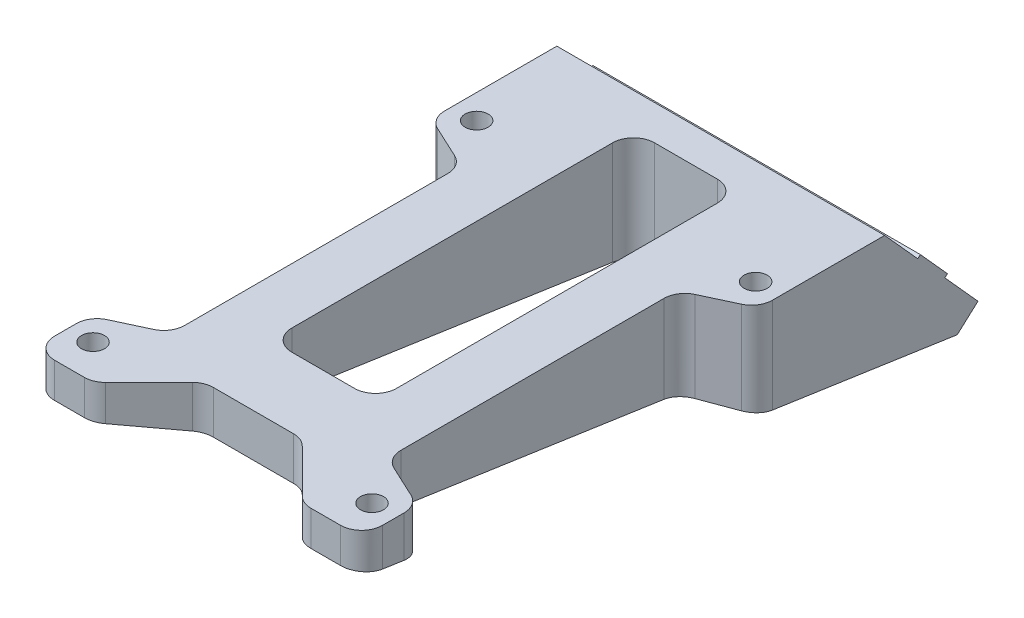
from build123d import *

# Parameters (mm, degrees)
EXTRUDE_2_DEPTH     = 5
SKETCH_3_R          = 1.65
CUT_EXTRUDE_1_DEPTH = 79.754364958
EXTRUDE_3_DEPTH     = 23.5
SKETCH_6_R          = 2.6
CUT_EXTRUDE_3_DEPTH = 83.719354566
CUT_EXTRUDE_4_REACH = 89.719
CUT_EXTRUDE_START   = -5
SKETCH_7_R          = 4.5
CUT_EXTRUDE_5_REACH = 85.529
CUT_EXTRUDE_START_2 = 3
SKETCH_8_R          = 3
SKETCH_4_W          = 15
SKETCH_4_H          = 52
CUT_EXTRUDE_2_DEPTH = 81.528760183
FILLET_1_R          = 3


with BuildPart() as part:
    # 草图2 → 凸台-拉伸2 (new body)
    with BuildSketch(Plane(origin=(0, 0, 0), x_dir=(1, 0, 0), z_dir=(0, 1, 0))):
        Polygon((0, 0), (23.5, 0), (23.5, -14), (23.5, -75), (0, -75), align=None)
    extrude_2 = extrude(amount=EXTRUDE_2_DEPTH)

    # 镜向1: 凸台-拉伸2 across plane
    add(extrude_2.mirror(Plane(origin=(0, 5, 75), x_dir=(0, 0, 1), z_dir=(1, 0, 0))))

    # 草图3 → 切除-拉伸1 (cut, through all)
    with BuildSketch(Plane(origin=(0, 5, 0), x_dir=(1, 0, 0), z_dir=(0, 1, 0))):
        with Locations((-20, -15)):
            Circle(SKETCH_3_R)
        with Locations((20, -15)):
            Circle(SKETCH_3_R)
        with Locations((-20, -70)):
            Circle(SKETCH_3_R)
        with Locations((20, -70)):
            Circle(SKETCH_3_R)
    extrude(amount=-CUT_EXTRUDE_1_DEPTH, mode=Mode.SUBTRACT)

    # 草图5 → 凸台-拉伸3 (add, symmetric)
    with BuildSketch(Plane(origin=(0, 0, 0), x_dir=(0, 0, -1), z_dir=(1, 0, 0))):
        Polygon((0, 0), (-75, 0), (10.410032825, -12.539418935), (13.382612127, -9.86289651), (8.631784822, -4.586568249), (9.003357235, -4.252002945), (5.122399718, 0.058237042), (4.750827305, -0.276328261), (0, 5), align=None)
    extrude(amount=EXTRUDE_3_DEPTH, both=True)

    # 草图6 → 切除-拉伸3 (cut, through all)
    with BuildSketch(Plane(origin=(0, 2.573244145, -2.857877151), x_dir=(1, 0, 0), z_dir=(0, 0.6691306063588544, -0.7431448254773979))):
        with Locations((-13.5, 6.284275873)):
            Circle(SKETCH_6_R)
        with Locations((13.5, 6.284275873)):
            Circle(SKETCH_6_R)
    extrude(amount=-CUT_EXTRUDE_3_DEPTH, mode=Mode.SUBTRACT)

    # 草图7 → 切除-拉伸4 (cut, up to next)
    with BuildSketch(Plane(origin=(0, 2.573244145, -2.857877151), x_dir=(1, 0, 0), z_dir=(0, 0.6691306063588544, -0.7431448254773979)).offset(CUT_EXTRUDE_START), mode=Mode.PRIVATE) as cut_extrude_4_sk1:
        with Locations((-13.5, 6.284275873)):
            Circle(SKETCH_7_R)
    cut_extrude_4_tool1 = extrude(cut_extrude_4_sk1.sketch, amount=-CUT_EXTRUDE_4_REACH, mode=Mode.PRIVATE) & part.part
    # 草图7 → 切除-拉伸4 (cut, up to next)
    with BuildSketch(Plane(origin=(0, 2.573244145, -2.857877151), x_dir=(1, 0, 0), z_dir=(0, 0.6691306063588544, -0.7431448254773979)).offset(CUT_EXTRUDE_START), mode=Mode.PRIVATE) as cut_extrude_4_sk2:
        with Locations((13.5, 6.284275873)):
            Circle(SKETCH_7_R)
    cut_extrude_4_tool2 = extrude(cut_extrude_4_sk2.sketch, amount=-CUT_EXTRUDE_4_REACH, mode=Mode.PRIVATE) & part.part
    add(cut_extrude_4_tool1.solids().sort_by_distance((-13.5, -5.442536, -3.347154))[0], mode=Mode.SUBTRACT)
    add(cut_extrude_4_tool2.solids().sort_by_distance((13.5, -5.442536, -3.347154))[0], mode=Mode.SUBTRACT)

    # 草图8 → 切除-拉伸5 (cut, up to next)
    with BuildSketch(Plane.XZ.offset(-5).offset(CUT_EXTRUDE_START_2), mode=Mode.PRIVATE) as cut_extrude_5_sk1:
        with Locations((-20, 15)):
            Circle(SKETCH_8_R)
    cut_extrude_5_tool1 = extrude(cut_extrude_5_sk1.sketch, amount=CUT_EXTRUDE_5_REACH, mode=Mode.PRIVATE) & part.part
    # 草图8 → 切除-拉伸5 (cut, up to next)
    with BuildSketch(Plane.XZ.offset(-5).offset(CUT_EXTRUDE_START_2), mode=Mode.PRIVATE) as cut_extrude_5_sk2:
        with Locations((20, 15)):
            Circle(SKETCH_8_R)
    cut_extrude_5_tool2 = extrude(cut_extrude_5_sk2.sketch, amount=CUT_EXTRUDE_5_REACH, mode=Mode.PRIVATE) & part.part
    # 草图8 → 切除-拉伸5 (cut, up to next)
    with BuildSketch(Plane.XZ.offset(-5).offset(CUT_EXTRUDE_START_2), mode=Mode.PRIVATE) as cut_extrude_5_sk3:
        with Locations((20, 70)):
            Circle(SKETCH_8_R)
    cut_extrude_5_tool3 = extrude(cut_extrude_5_sk3.sketch, amount=CUT_EXTRUDE_5_REACH, mode=Mode.PRIVATE) & part.part
    # 草图8 → 切除-拉伸5 (cut, up to next)
    with BuildSketch(Plane.XZ.offset(-5).offset(CUT_EXTRUDE_START_2), mode=Mode.PRIVATE) as cut_extrude_5_sk4:
        with Locations((-20, 70)):
            Circle(SKETCH_8_R)
    cut_extrude_5_tool4 = extrude(cut_extrude_5_sk4.sketch, amount=CUT_EXTRUDE_5_REACH, mode=Mode.PRIVATE) & part.part
    add(cut_extrude_5_tool1.solids().sort_by_distance((-20, 2, 15))[0], mode=Mode.SUBTRACT)
    add(cut_extrude_5_tool2.solids().sort_by_distance((20, 2, 15))[0], mode=Mode.SUBTRACT)
    add(cut_extrude_5_tool3.solids().sort_by_distance((20, 2, 70))[0], mode=Mode.SUBTRACT)
    add(cut_extrude_5_tool4.solids().sort_by_distance((-20, 2, 70))[0], mode=Mode.SUBTRACT)

    # 草图4 → 切除-拉伸2 (cut, through all)
    with BuildSketch(Plane(origin=(0, 5, 0), x_dir=(1, 0, 0), z_dir=(0, 1, 0))):
        with Locations((0, -31)):
            Rectangle(SKETCH_4_W, SKETCH_4_H)
        Polygon((-15, -75), (-7, -67), (7, -67), (15, -75), align=None)
        Polygon((-23.5, -67), (-15.5, -63.269538735), (-15.5, -21.730461265), (-23.5, -18), align=None)
        Polygon((15.5, -21.730461265), (23.5, -18), (23.5, -67), (15.5, -63.269538735), align=None)
    extrude(amount=-CUT_EXTRUDE_2_DEPTH, mode=Mode.SUBTRACT)

    # 圆角1
    fillet_1_edges = [part.edges().sort_by_distance(p)[0] for p in [
        (7.5, -2.638502448, 5),
        (-7.5, -2.638502448, 5),
        (7.5, 1.178670799, 57),
        (-7.5, 1.178670799, 57),
        (23.5, -1.684209136, 18),
        (15.5, -1.410366502, 21.730461265),
        (15.5, 1.638899944, 63.269538735),
        (23.5, 1.912742577, 67),
        (23.5, 2.5, 75),
        (15, 2.5, 75),
        (7, 1.912742577, 67),
        (-7, 1.912742577, 67),
        (-15, 2.5, 75),
        (-23.5, 2.5, 75),
        (-23.5, 1.912742577, 67),
        (-15.5, 1.638899944, 63.269538735),
        (-15.5, -1.410366502, 21.730461265),
        (-23.5, -1.684209136, 18),
    ]]
    fillet(fillet_1_edges, radius=FILLET_1_R)


solid = part.part
